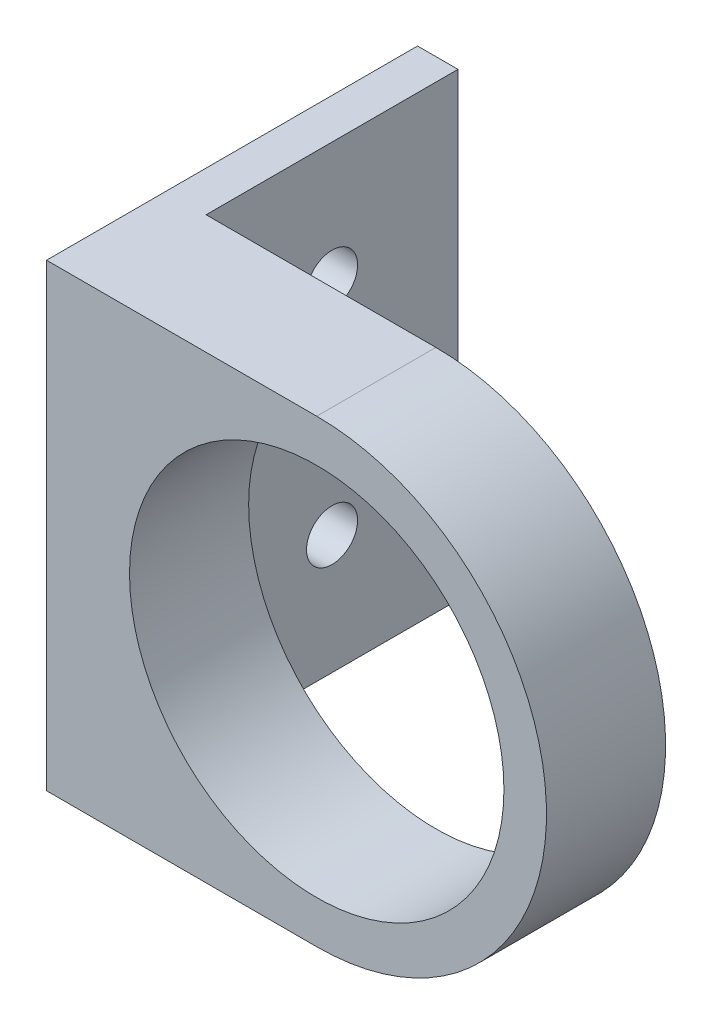
from build123d import *

# Parameters (mm, degrees)
SKETCH1_R           = 11
BOSS_EXTRUDE1_DEPTH = 7
BOSS_EXTRUDE2_DEPTH = 14.8
SKETCH4_R           = 1.5
CUT_EXTRUDE1_DEPTH  = 4.8


with BuildPart() as part:
    # Sketch1 → Boss-Extrude1 (new body)
    with BuildSketch(Plane.XY):
        with BuildLine():
            Line((-15.875, -13.5), (0, -13.5))
            ThreePointArc((0, -13.5), (13.5, 0), (0, 13.5))
            Line((0, 13.5), (-15.875, 13.5))
            Line((-15.875, 13.5), (-15.875, -13.5))
        make_face()
        Circle(SKETCH1_R, mode=Mode.SUBTRACT)
    extrude(amount=BOSS_EXTRUDE1_DEPTH)

    # Sketch3 → Boss-Extrude2 (add)
    with BuildSketch(Plane(origin=(0, 0, 0), x_dir=(-1, 0, 0), z_dir=(0, 0, -1))):
        Polygon((13.5, 0), (13.5, 13.5), (15.875, 13.5), (15.875, -13.5), (13.5, -13.5), align=None)
    extrude(amount=BOSS_EXTRUDE2_DEPTH)

    # Sketch4 → Cut-Extrude1 (cut)
    with BuildSketch(Plane(origin=(-13.5, 0, 0), x_dir=(0, 0, -1), z_dir=(1, 0, 0))):
        with Locations((7.4, 6.5)):
            Circle(SKETCH4_R)
        with Locations((7.4, -6.5)):
            Circle(SKETCH4_R)
    extrude(amount=-CUT_EXTRUDE1_DEPTH, mode=Mode.SUBTRACT)


solid = part.part
